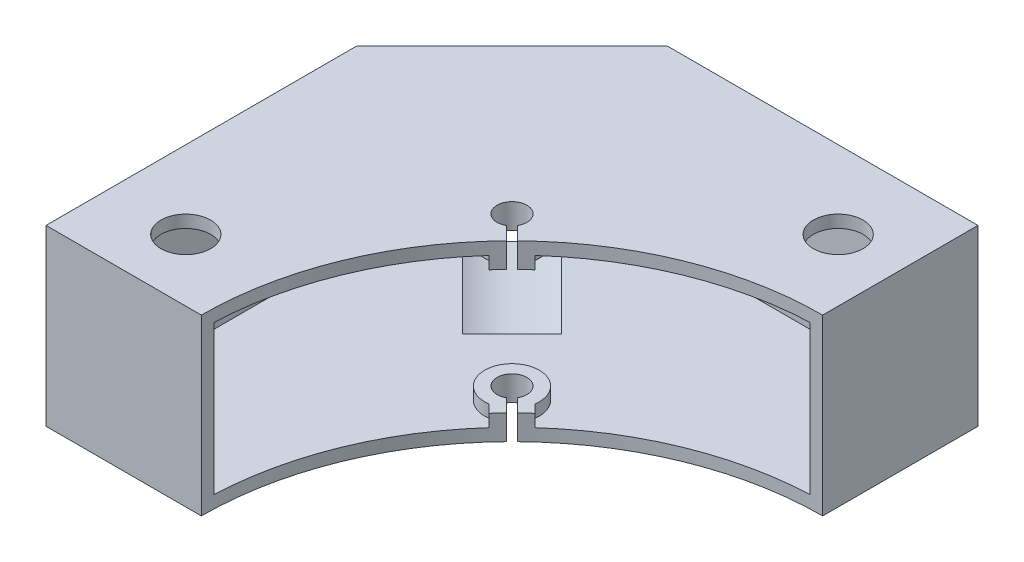
from build123d import *

# Parameters (mm, degrees)
BOSS_EXTRUDE1_DEPTH     = 28
SHELL1_T                = -2
CUT_EXTRUDE1_DEPTH      = 10
CUT_EXTRUDE1_DEPTH_BACK = 10
SKETCH9_R               = 6.4
SKETCH11_R              = 13.25
CUT_EXTRUDE2_DEPTH      = 20
SKETCH12_R              = 4
CUT_EXTRUDE3_DEPTH      = 2


with BuildPart() as part:
    # Sketch1 → Boss-Extrude1 (new body)
    with BuildSketch(Plane(origin=(0, 0, 0), x_dir=(1, 0, 0), z_dir=(0, 1, 0))):
        with BuildLine():
            Line((0, 0), (0, 50))
            Line((0, 50), (25, 75))
            Line((25, 75), (75, 75))
            Line((75, 75), (75, 50))
            ThreePointArc((75, 50), (56.143341661, 46.307952193), (40.071470685, 35.777057452))
            Line((40.071470685, 35.777057452), (37.950150342, 37.898377796))
            ThreePointArc((37.950150342, 37.898377796), (34.185662326, 40.814337674), (37.101622204, 37.049849658))
            Line((37.101622204, 37.049849658), (39.222942548, 34.928529315))
            ThreePointArc((39.222942548, 34.928529315), (28.692047807, 18.856658339), (25, 0))
            Line((25, 0), (0, 0))
        make_face()
    extrude(amount=BOSS_EXTRUDE1_DEPTH)

    # Shell1
    shell1_openings = [part.faces().sort_by_distance(p)[0] for p in [
        (56.143341661, 14, -46.307952193),
        (28.692047807, 14, -18.856658339),
    ]]
    offset(amount=SHELL1_T, openings=shell1_openings, kind=Kind.INTERSECTION)

    # Sketch9 → Cut-Extrude1 (cut, two sides: drawn at the far end of the back side and taken through both)
    with BuildSketch(Plane(origin=(0, 14, 0), x_dir=(1, 0, 0), z_dir=(0, 1, 0)).offset(-CUT_EXTRUDE1_DEPTH_BACK)):
        with Locations((36.184678266, 38.815321734)):
            Circle(SKETCH9_R)
    extrude(amount=CUT_EXTRUDE1_DEPTH + CUT_EXTRUDE1_DEPTH_BACK, mode=Mode.SUBTRACT)

    # Sketch11 → Cut-Extrude2 (cut)
    with BuildSketch(Plane(origin=(-25, 0, -25), x_dir=(-0.7071067811865435, 0, 0.7071067811865517), z_dir=(-0.7071067811865517, 0, -0.7071067811865435))):
        with Locations((-53.033008589, 14)):
            Circle(SKETCH11_R)
    extrude(amount=-CUT_EXTRUDE2_DEPTH, mode=Mode.SUBTRACT)

    # Sketch12 → Cut-Extrude3 (cut)
    with BuildSketch(Plane(origin=(0, 28, 0), x_dir=(1, 0, 0), z_dir=(0, 1, 0))):
        with Locations((65, 62.5)):
            Circle(SKETCH12_R)
        with Locations((12.5, 10)):
            Circle(SKETCH12_R)
    extrude(amount=-CUT_EXTRUDE3_DEPTH, mode=Mode.SUBTRACT)


solid = part.part
